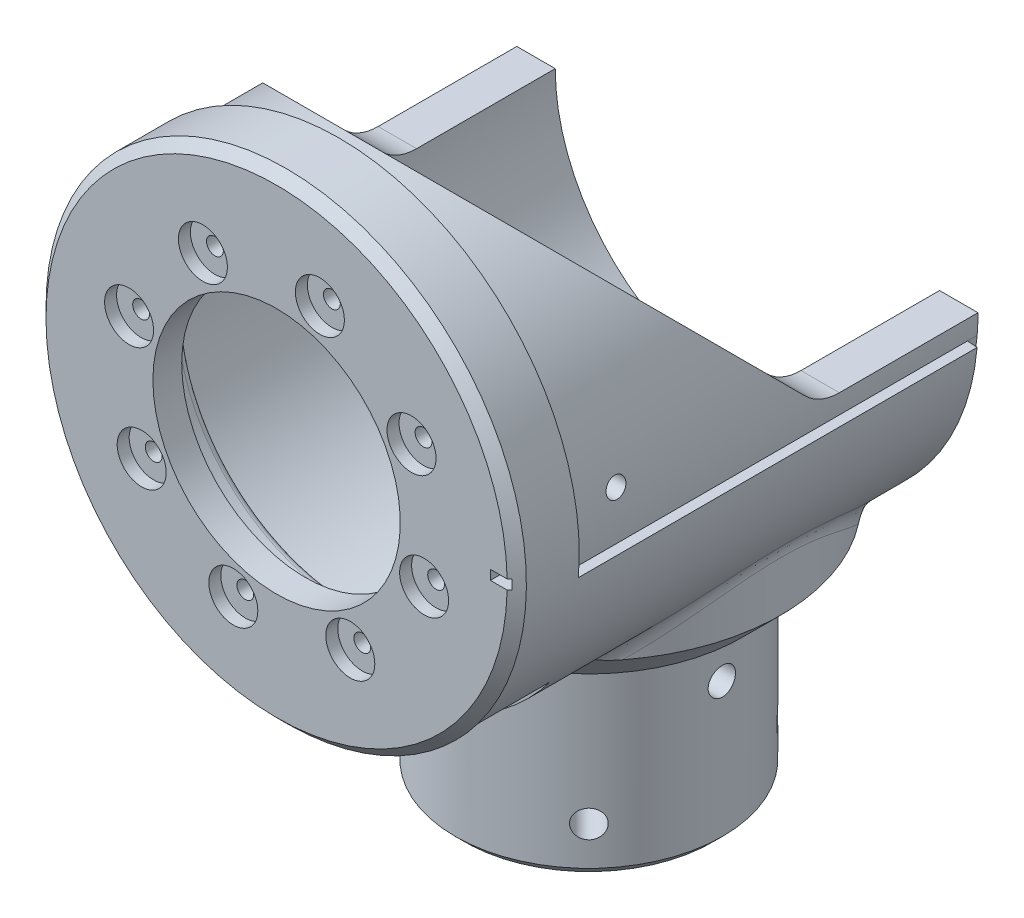
from build123d import *

# Parameters (mm, degrees)
SKETCH_6_R                = 50
EXTRUDE_4_DEPTH           = 65
SKETCH_7_R                = 40
EXTRUDE_5_DEPTH           = 30
CUT_EXTRUDE_1_DEPTH       = 130.32517173
CUT_EXTRUDE_1_DEPTH_BACK  = 130.32517173
SKETCH_20_R               = 27.825
EXTRUDE_8_DEPTH           = 40
CHAMFER_2_SIZE            = 8
CHAMFER_3_SIZE            = 2
CUT_EXTRUDE_START         = -32
CUT_EXTRUDE_7_DEPTH       = 32
CUT_EXTRUDE_9_DEPTH       = 141.445719219
FILLET_1_R                = 10
FILLET_2_R                = 5
CUT_EXTRUDE_START_2       = 47
SKETCH_21_W               = 15
SKETCH_21_H               = 14
CUT_EXTRUDE_10_DEPTH      = 78.411112968
SKETCH_23_R               = 1.1
CUT_EXTRUDE_11_DEPTH      = 3
SKETCH_24_R               = 2.05
CUT_EXTRUDE_12_DEPTH      = 6.5
SKETCH_25_W               = 4
SKETCH_25_H               = 2
CUT_EXTRUDE_13_DEPTH      = 5
CUT_EXTRUDE_14_DEPTH      = 130.32517168
CUT_EXTRUDE_14_DEPTH_BACK = 130.32517168
SKETCH_26_R               = 2.05
SKETCH_27_R               = 2.05
CUT_EXTRUDE_15_DEPTH      = 7
CUT_EXTRUDE_START_3       = 28
SKETCH_28_R               = 2.85
CUT_EXTRUDE_16_DEPTH      = 15
SKETCH_29_R               = 2.85
CUT_EXTRUDE_17_DEPTH      = 15
PATTERN_CIRCULAR_2_COUNT  = 4
SKETCH2_R                 = 25.75
CUT_EXTRUDE1_DEPTH        = 135.908302358
CUT_EXTRUDE2_DEPTH        = 135.908302358
CUT_EXTRUDE2_DEPTH_BACK   = 6.5
SKETCH3_R                 = 40
SKETCH4_R                 = 35.1
CUT_EXTRUDE3_DEPTH        = 15.5
SKETCH5_R                 = 1.75
CUT_EXTRUDE4_DEPTH        = 14
SKETCH6_R                 = 5.1
CUT_EXTRUDE5_DEPTH        = 2.5
CUT_EXTRUDE6_REACH        = 164.25
SKETCH7_R                 = 16
CUT_EXTRUDE11_DEPTH       = 2
FILLET1_R                 = 2
FILLET3_R                 = 1.5


with BuildPart() as part:
    # Эскиз6 → Бобышка-Вытянуть4 (new, symmetric)
    with BuildSketch(Plane.XY):
        with Locations((0, 50)):
            Circle(SKETCH_6_R)
    extrude(amount=EXTRUDE_4_DEPTH, both=True)

    # Эскиз7 → Бобышка-Вытянуть5 (add)
    with BuildSketch(Plane(origin=(0, 0, 0), x_dir=(1, 0, 0), z_dir=(0, 1, 0))):
        Circle(SKETCH_7_R)
    extrude(amount=EXTRUDE_5_DEPTH)

    # Эскиз9 → Вырез-Вытянуть1 (cut, two sides: drawn at the far end of the back side and taken through both)
    with BuildSketch(Plane(origin=(0, 0, 0), x_dir=(0, 0, -1), z_dir=(1, 0, 0)).offset(-CUT_EXTRUDE_1_DEPTH_BACK)):
        Polygon((65, 50), (0, 50), (-50, 100), (65, 100), align=None)
    extrude(amount=CUT_EXTRUDE_1_DEPTH + CUT_EXTRUDE_1_DEPTH_BACK, mode=Mode.SUBTRACT)

    # Эскиз20 → Бобышка-Вытянуть8 (add)
    with BuildSketch(Plane.XZ):
        with Locations(Location((0, 0, 0), (0, 0, 90))):
            Circle(SKETCH_20_R)
    extrude(amount=EXTRUDE_8_DEPTH)

    # Фаска2
    # the kernel refuses this chamfer: 8 mm, written as the material it takes off along each edge
    with BuildSketch(Plane(origin=(0, 0, 0), x_dir=(0, 0, 1), z_dir=(-1, 0, 0))) as chamfer_2_piece_1_section:
        Polygon((40, CHAMFER_2_SIZE), (40 - CHAMFER_2_SIZE, 0), (40, 0), align=None)
    chamfer_2_piece_1 = revolve(axis=Axis((0, 0, 0), (0, 1, 0)), revolution_arc=180, mode=Mode.PRIVATE)
    chamfer_2_piece_1 = chamfer_2_piece_1 - Plane(origin=(0, 50, 0), x_dir=(1, 0, 0), z_dir=(0, 0, 1)) * Cylinder(50, 160, mode=Mode.PRIVATE)
    add(chamfer_2_piece_1, mode=Mode.SUBTRACT)
    with BuildSketch(Plane(origin=(0, 0, 0), x_dir=(0, 0, -1), z_dir=(1, 0, 0))) as chamfer_2_piece_2_section:
        Polygon((40, CHAMFER_2_SIZE), (40 - CHAMFER_2_SIZE, 0), (40, 0), align=None)
    chamfer_2_piece_2 = revolve(axis=Axis((0, 0, 0), (0, 1, 0)), revolution_arc=180, mode=Mode.PRIVATE)
    chamfer_2_piece_2 = chamfer_2_piece_2 - Plane(origin=(0, 50, 0), x_dir=(1, 0, 0), z_dir=(0, 0, 1)) * Cylinder(50, 160, mode=Mode.PRIVATE)
    add(chamfer_2_piece_2, mode=Mode.SUBTRACT)

    # Фаска3
    chamfer_3_edges = [part.edges().sort_by_distance(p)[0] for p in [
        (0, -40, -27.825),
        (-50, 50, 65),
    ]]
    chamfer(chamfer_3_edges, length=CHAMFER_3_SIZE)

    # Эскиз16 → Вырез-Вытянуть7 (cut)
    with BuildSketch(Plane(origin=(0, 0, -65), x_dir=(-1, 0, 0), z_dir=(0, 0, -1)).offset(CUT_EXTRUDE_START)):
        with BuildLine():
            Line((50, 50), (-50, 50))
            ThreePointArc((-50, 50), (0, 0), (50, 50))
        make_face()
    extrude(amount=CUT_EXTRUDE_7_DEPTH, mode=Mode.SUBTRACT)

    # Эскиз18 → Вырез-Вытянуть9 (cut, through all)
    with BuildSketch(Plane(origin=(0, 0, 52), x_dir=(-1, 0, 0), z_dir=(0, 0, -1))):
        with BuildLine():
            Line((47.817345508, 45.816524348), (49.809734905, 45.642212863))
            ThreePointArc((49.809734905, 45.642212863), (0, 100), (-49.809734905, 45.642212863))
            Line((-49.809734905, 45.642212863), (-47.817345508, 45.816524348))
            ThreePointArc((-47.817345508, 45.816524348), (0, 98), (47.817345508, 45.816524348))
        make_face()
    extrude(amount=CUT_EXTRUDE_9_DEPTH, mode=Mode.SUBTRACT)

    # Скругление1
    fillet_1_edges = [part.edges().sort_by_distance(p)[0] for p in [
        (0, 50, 0),
    ]]
    fillet(fillet_1_edges, radius=FILLET_1_R)

    # Скругление2
    fillet_2_edges = [part.edges().sort_by_distance(p)[0] for p in [
        (40, 20, 0),
        (-40, 20, 1e-09),
    ]]
    fillet(fillet_2_edges, radius=FILLET_2_R)

    # Эскиз21 → Вырез-Вытянуть10 (cut, through all)
    with BuildSketch(Plane(origin=(-23.75, 23.75, 0), x_dir=(0, 0, 1), z_dir=(0.7071067811865464, -0.7071067811865488, 0)).offset(CUT_EXTRUDE_START_2)):
        with Locations((55.5, -35.355339059)):
            Rectangle(SKETCH_21_W, SKETCH_21_H)
    extrude(amount=CUT_EXTRUDE_10_DEPTH, mode=Mode.SUBTRACT)

    # Эскиз23 → Вырез-Вытянуть11 (cut)
    with BuildSketch(Plane(origin=(9.484018716, -9.484018716, 0), x_dir=(0, 0, -1), z_dir=(0.7071067811865465, -0.7071067811865486, 0))):
        with Locations(Location((-53, 38.355339059, 0), (0, 0, 90))):
            Circle(SKETCH_23_R)
    extrude(amount=-CUT_EXTRUDE_11_DEPTH, mode=Mode.SUBTRACT)

    # Эскиз24 → Вырез-Вытянуть12 (cut)
    with BuildSketch(Plane(origin=(9.484018716, -9.484018716, 0), x_dir=(0, 0, -1), z_dir=(0.7071067811865465, -0.7071067811865486, 0))):
        with Locations(Location((-53, 32.355339059, 0), (0, 0, 90))):
            Circle(SKETCH_24_R)
    extrude(amount=-CUT_EXTRUDE_12_DEPTH, mode=Mode.SUBTRACT)

    # Эскиз25 → Вырез-Вытянуть13 (cut)
    with BuildSketch(Plane.XY.offset(65)):
        with Locations((46.5, 50)):
            Rectangle(SKETCH_25_W, SKETCH_25_H)
    extrude(amount=-CUT_EXTRUDE_13_DEPTH, mode=Mode.SUBTRACT)

    # Эскиз26 → Вырез-Вытянуть14 (cut, two sides: drawn at the far end of the back side and taken through both)
    with BuildSketch(Plane(origin=(0, 0, 0), x_dir=(0, 0, -1), z_dir=(1, 0, 0)).offset(-CUT_EXTRUDE_14_DEPTH_BACK)):
        with Locations((-42, 55.816524348)):
            Circle(SKETCH_26_R)
    extrude(amount=CUT_EXTRUDE_14_DEPTH + CUT_EXTRUDE_14_DEPTH_BACK, mode=Mode.SUBTRACT)

    # Эскиз27 → Вырез-Вытянуть15 (cut)
    with BuildSketch(Plane(origin=(0, 0, -34), x_dir=(-1, 0, 0), z_dir=(0, 0, -1))):
        with Locations((-25, 13.79226602)):
            Circle(SKETCH_27_R)
        with Locations((25, 13.79226602)):
            Circle(SKETCH_27_R)
        with Locations((-42.572748226, 38.884195552)):
            Circle(SKETCH_27_R)
        with Locations((42.572748226, 38.884195552)):
            Circle(SKETCH_27_R)
    extrude(amount=-CUT_EXTRUDE_15_DEPTH, mode=Mode.SUBTRACT)

    # Эскиз28 → Вырез-Вытянуть16 (cut)
    with BuildSketch(Plane.XY.offset(CUT_EXTRUDE_START_3)):
        with Locations((0, -10)):
            Circle(SKETCH_28_R)
    cut_extrude_16 = extrude(amount=-CUT_EXTRUDE_16_DEPTH, mode=Mode.SUBTRACT)

    # Эскиз29 → Вырез-Вытянуть17 (cut)
    with BuildSketch(Plane(origin=(0, 0, 0), x_dir=(-0.7071067811865488, 0, -0.7071067811865464), z_dir=(0.7071067811865464, 0, -0.7071067811865488)).offset(CUT_EXTRUDE_START_3)):
        with Locations((0, -30)):
            Circle(SKETCH_29_R)
    cut_extrude_17 = extrude(amount=-CUT_EXTRUDE_17_DEPTH, mode=Mode.SUBTRACT)

    # Круговой массив2: Вырез-Вытянуть16, Вырез-Вытянуть17 ×4 about axis
    pattern_circular_2_axis = Axis((0, 0, 0), (0, 1, 0))
    add([cut_extrude_16.rotate(pattern_circular_2_axis, i * 360 / PATTERN_CIRCULAR_2_COUNT) for i in range(1, PATTERN_CIRCULAR_2_COUNT)], mode=Mode.SUBTRACT)
    add([cut_extrude_17.rotate(pattern_circular_2_axis, i * 360 / PATTERN_CIRCULAR_2_COUNT) for i in range(1, PATTERN_CIRCULAR_2_COUNT)], mode=Mode.SUBTRACT)

    # Sketch2 → Cut-Extrude1 (cut, through all)
    with BuildSketch(Plane(origin=(0, 0, 42.5), x_dir=(-1, 0, 0), z_dir=(0, 0, -1))):
        with Locations((0, 50)):
            Circle(SKETCH2_R)
    extrude(amount=-CUT_EXTRUDE1_DEPTH, mode=Mode.SUBTRACT)

    # Sketch3 → Cut-Extrude2 (cut, two sides: drawn at the far end of the back side and taken through both)
    with BuildSketch(Plane(origin=(0, 0, 42.5), x_dir=(-1, 0, 0), z_dir=(0, 0, -1)).offset(-CUT_EXTRUDE2_DEPTH_BACK)):
        with Locations(Location((0, 50, 0), (0, 0, 180))):
            Circle(SKETCH3_R)
    extrude(amount=CUT_EXTRUDE2_DEPTH + CUT_EXTRUDE2_DEPTH_BACK, mode=Mode.SUBTRACT)

    # Sketch4 → Cut-Extrude3 (cut)
    with BuildSketch(Plane(origin=(0, 0, 43.5), x_dir=(-1, 0, 0), z_dir=(0, 0, -1))):
        with Locations(Location((0, 50, 0), (0, 0, 180))):
            Circle(SKETCH4_R)
    extrude(amount=-CUT_EXTRUDE3_DEPTH, mode=Mode.SUBTRACT)

    # Sketch5 → Cut-Extrude4 (cut)
    with BuildSketch(Plane.XY.offset(65)):
        with Locations((-15.341979706, 78.082443959)):
            Circle(SKETCH5_R)
        with Locations((9.008868669, 80.705704442)):
            Circle(SKETCH5_R)
        with Locations((28.082443959, 65.341979706)):
            Circle(SKETCH5_R)
        with Locations((30.705704442, 40.991131331)):
            Circle(SKETCH5_R)
        with Locations((15.341979706, 21.917556041)):
            Circle(SKETCH5_R)
        with Locations((-9.008868669, 19.294295558)):
            Circle(SKETCH5_R)
        with Locations((-28.082443959, 34.658020294)):
            Circle(SKETCH5_R)
        with Locations((-30.705704442, 59.008868669)):
            Circle(SKETCH5_R)
    extrude(amount=-CUT_EXTRUDE4_DEPTH, mode=Mode.SUBTRACT)

    # Sketch6 → Cut-Extrude5 (cut)
    with BuildSketch(Plane.XY.offset(65)):
        with Locations((-15.341979706, 78.082443959)):
            Circle(SKETCH6_R)
        with Locations((9.008868669, 80.705704442)):
            Circle(SKETCH6_R)
        with Locations((28.082443959, 65.341979706)):
            Circle(SKETCH6_R)
        with Locations((30.705704442, 40.991131331)):
            Circle(SKETCH6_R)
        with Locations((15.341979706, 21.917556041)):
            Circle(SKETCH6_R)
        with Locations((-9.008868669, 19.294295558)):
            Circle(SKETCH6_R)
        with Locations((-28.082443959, 34.658020294)):
            Circle(SKETCH6_R)
        with Locations((-30.705704442, 59.008868669)):
            Circle(SKETCH6_R)
    extrude(amount=-CUT_EXTRUDE5_DEPTH, mode=Mode.SUBTRACT)

    # Sketch7 → Cut-Extrude6 (cut, up to next)
    with BuildSketch(Plane.XZ.offset(40), mode=Mode.PRIVATE) as cut_extrude6_sk1:
        with Locations(Location((0, 0, 0), (0, 0, 270))):
            Circle(SKETCH7_R)
    cut_extrude6_tool1 = extrude(cut_extrude6_sk1.sketch, amount=-CUT_EXTRUDE6_REACH, mode=Mode.PRIVATE) & part.part
    add(cut_extrude6_tool1.solids().sort_by_distance((0, -40, 0))[0], mode=Mode.SUBTRACT)

    # Sketch8 → Cut-Extrude11 (cut)
    with BuildSketch(Plane(origin=(0, 0, -33), x_dir=(1, 0, 0), z_dir=(0, 0, -1))):
        with BuildLine():
            Line((-49.809734905, -45.642212863), (-47.817345508, -45.816524348))
            ThreePointArc((-47.817345508, -45.816524348), (0, -1.624189646), (47.817345508, -45.816524348))
            Line((47.817345508, -45.816524348), (49.809734905, -45.642212863))
            ThreePointArc((49.809734905, -45.642212863), (0, 0.570772799), (-49.809734905, -45.642212863))
        make_face()
    extrude(amount=-CUT_EXTRUDE11_DEPTH, mode=Mode.SUBTRACT)

    # Fillet1
    fillet1_edges = [part.edges().sort_by_distance(p)[0] for p in [
        (0, 9.999999997, 15.999999999),
        (0, -40, 16),
    ]]
    fillet(fillet1_edges, radius=FILLET1_R)

    # Fillet3
    fillet3_edges = [part.edges().sort_by_distance(p)[0] for p in [
        (-35.1, 50, 49),
    ]]
    fillet(fillet3_edges, radius=FILLET3_R)


solid = part.part
